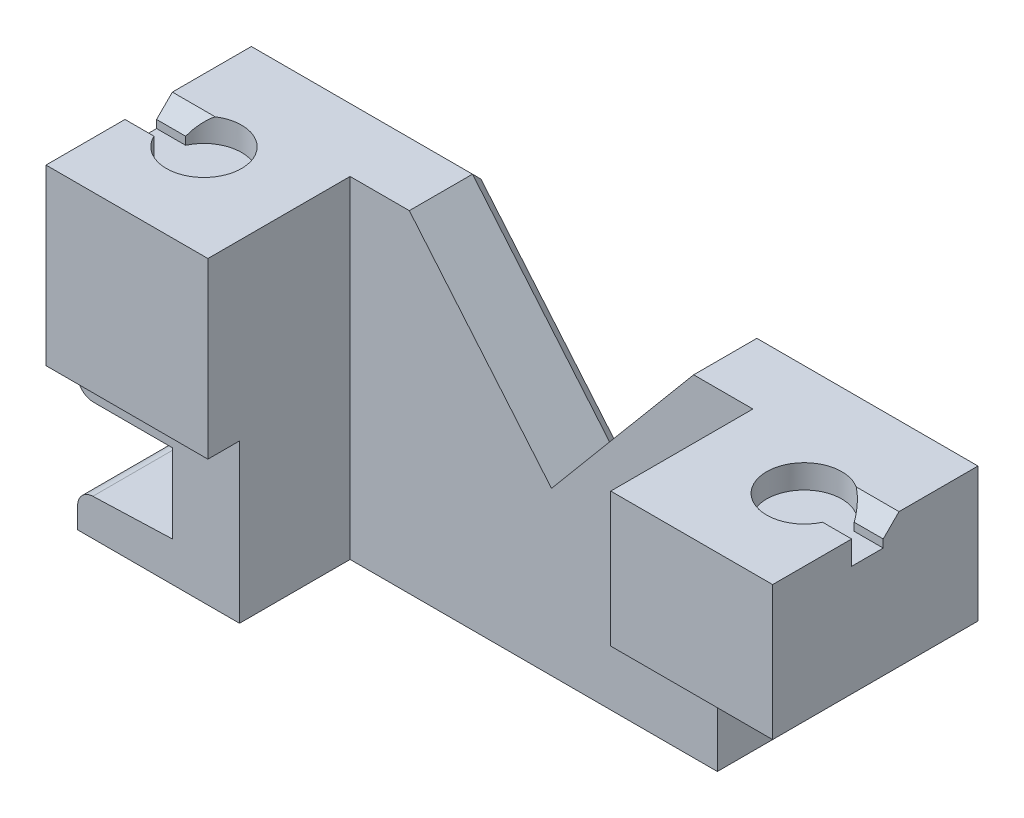
from build123d import *

# Parameters (mm, degrees)
BOSS_EXTRUDE1_DEPTH = 9.5
SKETCH5_R           = 2.38125
CUT_EXTRUDE1_DEPTH  = 1.5
SKETCH9_W           = 21
SKETCH9_H           = 5
BOSS_EXTRUDE6_DEPTH = 9
SKETCH10_W          = 21
SKETCH10_H          = 14
CUT_EXTRUDE4_DEPTH  = 28.626979567
CUT_EXTRUDE5_DEPTH  = 5
SKETCH12_W          = 24
SKETCH12_H          = 9
BOSS_EXTRUDE7_DEPTH = 5
CUT_EXTRUDE6_DEPTH  = 6
SKETCH15_W          = 46
SKETCH15_H          = 3.5
CUT_EXTRUDE7_DEPTH  = 16.5
SKETCH16_W          = 12.5
SKETCH16_H          = 3.5
CUT_EXTRUDE8_DEPTH  = 16.5
BOSS_EXTRUDE8_DEPTH = 5
SKETCH18_W          = 25.5
SKETCH18_H          = 8.5
CUT_EXTRUDE9_DEPTH  = 9
BOSS_EXTRUDE9_DEPTH = 9
FILLET1_R           = 1
SKETCH20_W          = 10.25
SKETCH20_H          = 10
CUT_EXTRUDE10_DEPTH = 2
SKETCH23_W          = 1.838900381
SKETCH23_H          = 2
CUT_EXTRUDE11_DEPTH = 1.5
CHAMFER1_SIZE       = 1
CHAMFER2_SIZE       = 1


with BuildPart() as part:
    # Sketch2 → Boss-Extrude1 (new, symmetric)
    with BuildSketch(Plane.XY):
        Polygon((-12, 3), (-12, 12), (-23, 12), (-23, 0), (23, 0), (23, 12), (12, 12), (12, 3), align=None)
    extrude(amount=BOSS_EXTRUDE1_DEPTH, both=True)

    # Sketch5 → Cut-Extrude1 (cut)
    with BuildSketch(Plane(origin=(0, 12, 0), x_dir=(1, 0, 0), z_dir=(0, 1, 0))):
        with Locations(Location((-19, 1.5, 0), (0, 0, 180))):
            Circle(SKETCH5_R)
        with Locations(Location((19, 1.5, 0), (0, 0, 180))):
            Circle(SKETCH5_R)
    extrude(amount=-CUT_EXTRUDE1_DEPTH, mode=Mode.SUBTRACT)

    # Sketch9 → Boss-Extrude6 (add)
    with BuildSketch(Plane.XZ):
        with Locations((0, -7)):
            Rectangle(SKETCH9_W, SKETCH9_H)
    extrude(amount=BOSS_EXTRUDE6_DEPTH)

    # Sketch10 → Cut-Extrude4 (cut, through all)
    with BuildSketch(Plane.XZ):
        with Locations((0, 2.5)):
            Rectangle(SKETCH10_W, SKETCH10_H)
    extrude(amount=-CUT_EXTRUDE4_DEPTH, mode=Mode.SUBTRACT)

    # Sketch11 → Cut-Extrude5 (cut)
    with BuildSketch(Plane.XY.offset(9.5)):
        Polygon((10.5, 3), (10.5, 0), (23, 0), (23, 12), (12, 12), (12, 3), align=None)
        Polygon((-10.5, 0), (-10.5, 3), (-12, 3), (-12, 12), (-23, 12), (-23, 0), align=None)
    extrude(amount=-CUT_EXTRUDE5_DEPTH, mode=Mode.SUBTRACT)

    # Sketch12 → Boss-Extrude7 (add)
    with BuildSketch(Plane(origin=(0, 0, -9.5), x_dir=(-1, 0, 0), z_dir=(0, 0, -1))):
        with Locations((0, 7.5)):
            Rectangle(SKETCH12_W, SKETCH12_H)
    extrude(amount=-BOSS_EXTRUDE7_DEPTH)

    # Sketch13 → Cut-Extrude6 (cut)
    with BuildSketch(Plane.XY.offset(-4.5)):
        Polygon((-9, 12), (0, 1.274217667), (9, 12), align=None)
    extrude(amount=-CUT_EXTRUDE6_DEPTH, mode=Mode.SUBTRACT)

    # Sketch15 → Cut-Extrude7 (cut)
    with BuildSketch(Plane.XY.offset(-4.5)):
        with Locations((0, 1.75)):
            Rectangle(SKETCH15_W, SKETCH15_H)
    extrude(amount=CUT_EXTRUDE7_DEPTH, mode=Mode.SUBTRACT)

    # Sketch16 → Cut-Extrude8 (cut)
    with BuildSketch(Plane.XY.offset(-4.5)):
        with Locations((-16.75, 1.75)):
            Rectangle(SKETCH16_W, SKETCH16_H)
        with Locations((16.75, 1.75)):
            Rectangle(SKETCH16_W, SKETCH16_H)
    extrude(amount=-CUT_EXTRUDE8_DEPTH, mode=Mode.SUBTRACT)

    # Sketch17 → Boss-Extrude8 (add)
    with BuildSketch(Plane(origin=(0, 0, -9.5), x_dir=(-1, 0, 0), z_dir=(0, 0, -1))):
        Polygon((10.5, 3.5), (23, 3.5), (23, -1.5), (17, -1.5), (17, -6.5), (23, -6.709524617), (23, -9), (10.5, -9), align=None)
    extrude(amount=-BOSS_EXTRUDE8_DEPTH)

    # Sketch18 → Cut-Extrude9 (cut)
    with BuildSketch(Plane.XY.offset(-4.5)):
        with Locations((0, 7.75)):
            Rectangle(SKETCH18_W, SKETCH18_H)
    extrude(amount=CUT_EXTRUDE9_DEPTH, mode=Mode.SUBTRACT)

    # Sketch19 → Boss-Extrude9 (add)
    with BuildSketch(Plane.XY.offset(-4.5)):
        Polygon((-12.75, 3.5), (-23, 3.5), (-23, -1.5), (-17, -1.5), (-17, -6.5), (-23, -6.709524617), (-23, -9), (-12.75, -9), align=None)
    extrude(amount=BOSS_EXTRUDE9_DEPTH)

    # Fillet1
    fillet1_edges = [part.edges().sort_by_distance(p)[0] for p in [
        (-23, -1.5, -2.5),
        (-23, -6.709524617, -2.5),
    ]]
    fillet(fillet1_edges, radius=FILLET1_R)

    # Sketch20 → Cut-Extrude10 (cut)
    with BuildSketch(Plane.XY.offset(4.5)):
        with Locations((-17.875, -4)):
            Rectangle(SKETCH20_W, SKETCH20_H)
    extrude(amount=-CUT_EXTRUDE10_DEPTH, mode=Mode.SUBTRACT)

    # Sketch23 → Cut-Extrude11 (cut)
    with BuildSketch(Plane(origin=(0, 12, 0), x_dir=(1, 0, 0), z_dir=(0, 1, 0))):
        with Locations((-22.080549809, 1.5)):
            Rectangle(SKETCH23_W, SKETCH23_H)
        with Locations((22.080549809, 1.5)):
            Rectangle(SKETCH23_W, SKETCH23_H)
    extrude(amount=-CUT_EXTRUDE11_DEPTH, mode=Mode.SUBTRACT)

    # Chamfer1
    chamfer1_edges = [part.edges().sort_by_distance(p)[0] for p in [
        (-22.080549809, 12, -2.5),
        (22.080549809, 12, -2.5),
    ]]
    chamfer(chamfer1_edges, length=CHAMFER1_SIZE)

    # Chamfer2
    chamfer2_edges = [part.edges().sort_by_distance(p)[0] for p in [
        (16, 12, -9.5),
        (-16, 12, -9.5),
        (4.5, 6.637108833, -9.5),
        (-4.5, 6.637108833, -9.5),
        (23, 7.75, -9.5),
        (16.75, 3.5, -9.5),
        (-23, -8.337606696, -9.5),
        (-17, -4, -9.5),
        (-19.5, -1.5, -9.5),
        (-19.517449748, -6.587911282, -9.5),
        (-22.7193398, -6.980555021, -9.5),
        (-22.707106781, -1.207106781, -9.5),
        (10.5, -2.75, -9.5),
        (-6.25, -9, -9.5),
        (-23, 5.75, -9.5),
    ]]
    chamfer(chamfer2_edges, length=CHAMFER2_SIZE - 0.0001)  # a hair under: the kernel refuses the full size


solid = part.part
